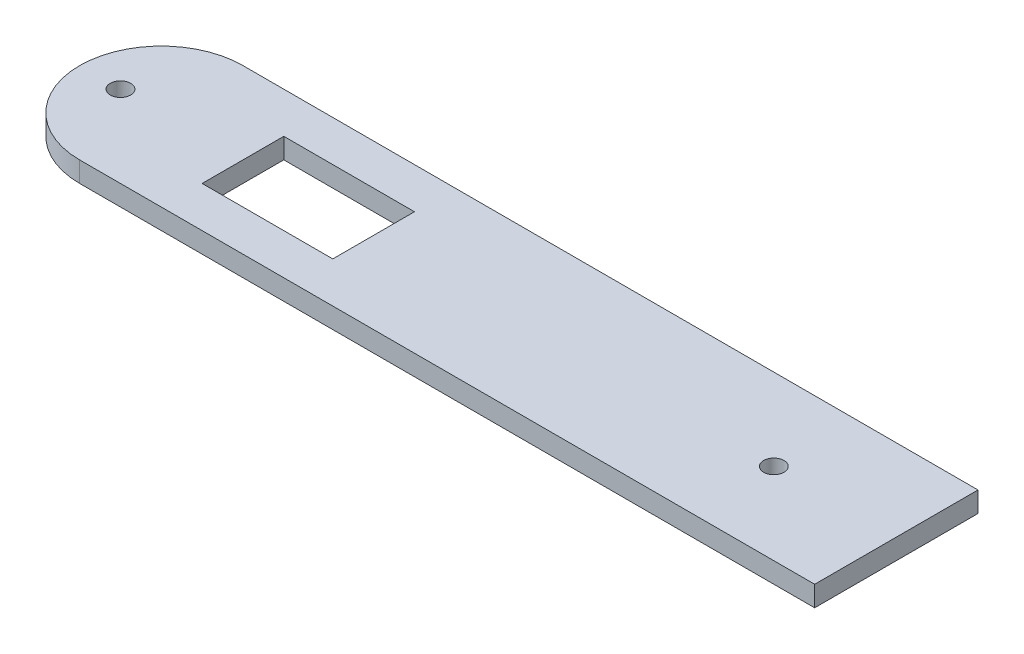
from build123d import *

# Parameters (mm, degrees)
SKETCH1_W                   = 254
SKETCH1_H                   = 50.8
BOSS_EXTRUDE1_DEPTH         = 6.35
F_1_4_0_25_DIAMETER_HOLE1_D = 6.35
FILLET1_R                   = 25.4
SKETCH4_W                   = 40.64
SKETCH4_H                   = 25.4
CUT_EXTRUDE1_DEPTH          = 25.4


with BuildPart() as part:
    # Sketch1 → Boss-Extrude1 (new body)
    with BuildSketch(Plane(origin=(0, 0, 0), x_dir=(1, 0, 0), z_dir=(0, 1, 0))):
        with Locations((92.878696742, 9.930827068)):
            Rectangle(SKETCH1_W, SKETCH1_H)
    extrude(amount=BOSS_EXTRUDE1_DEPTH)

    # 1/4 (0.25) Diameter Hole1 (through all)
    with Locations(Plane(origin=(0, 6.35, 0), x_dir=(1, 0, 0), z_dir=(0, 1, 0))):
        with Locations((-21.421303258, 9.930827068), (181.778696742, 9.930827068)):
            Hole(F_1_4_0_25_DIAMETER_HOLE1_D / 2)

    # Fillet1
    fillet1_edges = [part.edges().sort_by_distance(p)[0] for p in [
        (-34.121303258, 3.175, 15.469172932),
        (-34.121303258, 3.175, -35.330827068),
    ]]
    fillet(fillet1_edges, radius=FILLET1_R - 0.0001)  # a hair under: the kernel refuses the full size

    # Sketch4 → Cut-Extrude1 (cut)
    with BuildSketch(Plane(origin=(0, 6.35, 0), x_dir=(1, 0, 0), z_dir=(0, 1, 0))):
        with Locations((36.998696742, 9.930827068)):
            Rectangle(SKETCH4_W, SKETCH4_H)
    extrude(amount=-CUT_EXTRUDE1_DEPTH, mode=Mode.SUBTRACT)


solid = part.part
